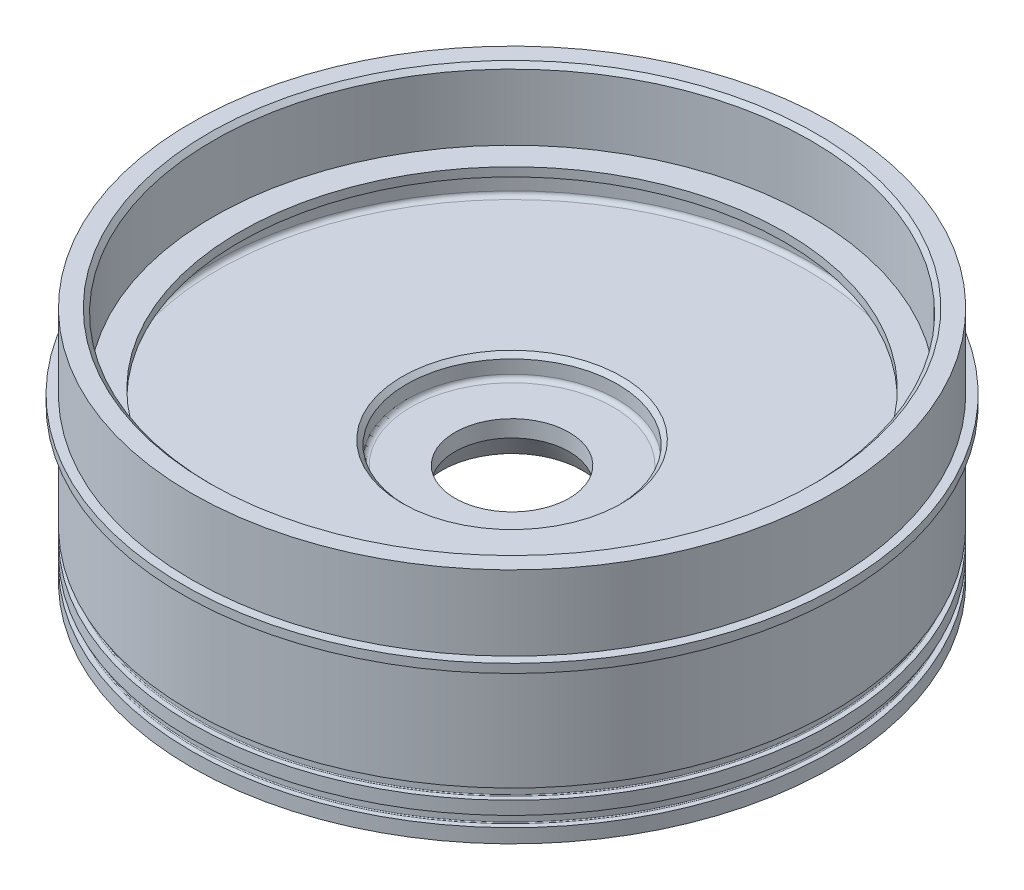
from build123d import *

# Parameters (mm, degrees)
SMUSSO1_SIZE  = 3
SMUSSO1_SIZE2 = 5.196152423
SMUSSO2_SIZE  = 1
RACCORDO1_R   = 1
SMUSSO3_SIZE  = 1
RACCORDO2_R   = 0.2
SCHIZZO2_W    = 11
SCHIZZO2_H    = 5
RACCORDO3_R   = 1
SMUSSO4_SIZE  = 1


with BuildPart() as part:
    # Schizzo1 → Rivoluzione1 (revolve)
    with BuildSketch(Plane.XY):
        Polygon((-69, 0), (-13, 0), (-13, 14), (-68, 14), (-68, 22), (-62, 22), (-62, 24), (-68, 24), (-68, 40), (-73, 40), (-73, 23), (-75, 23), (-75, 21), (-73, 21), (-73, -3), (-71.7, -3), (-71.7, -5.4), (-73, -5.4), (-73, -8.4), (-71.7, -8.4), (-71.7, -10.8), (-73, -10.8), (-73, -14), (-69, -14), align=None)
    revolve(axis=Axis((0, 0, 0), (0, 1, 0)))

    # Smusso1
    smusso1_edges = [part.edges().sort_by_distance(p)[0] for p in [
        (13, 0, 0),
    ]]
    smusso1_side = [part.faces().sort_by_distance(p)[0] for p in [
        (67.048385284, 0, 0),
    ]]
    chamfer(smusso1_edges, length=SMUSSO1_SIZE, length2=SMUSSO1_SIZE2, reference=smusso1_side[0])

    # Smusso2
    smusso2_edges = [part.edges().sort_by_distance(p)[0] for p in [
        (69, -14, 0),
    ]]
    chamfer(smusso2_edges, length=SMUSSO2_SIZE)

    # Raccordo1
    raccordo1_edges = [part.edges().sort_by_distance(p)[0] for p in [
        (69, 0, 0),
        (68, 14, 0),
    ]]
    fillet(raccordo1_edges, radius=RACCORDO1_R)

    # Smusso3
    smusso3_edges = [part.edges().sort_by_distance(p)[0] for p in [
        (68, 40, 0),
    ]]
    chamfer(smusso3_edges, length=SMUSSO3_SIZE)

    # Raccordo2
    raccordo2_edges = [part.edges().sort_by_distance(p)[0] for p in [
        (71.7, -8.4, 0),
        (71.7, -10.8, 0),
        (71.7, -3, 0),
        (71.7, -5.4, 0),
    ]]
    fillet(raccordo2_edges, radius=RACCORDO2_R)

    # Schizzo2 → Taglia-Rivoluzione1 (revolve, cut)
    with BuildSketch(Plane.XY):
        with Locations((-18.5, 11.5)):
            Rectangle(SCHIZZO2_W, SCHIZZO2_H)
    revolve(axis=Axis((0, 0, 0), (0, 1, 0)), mode=Mode.SUBTRACT)

    # Raccordo3
    raccordo3_edges = [part.edges().sort_by_distance(p)[0] for p in [
        (24, 9, 0),
    ]]
    fillet(raccordo3_edges, radius=RACCORDO3_R)

    # Smusso4
    smusso4_edges = [part.edges().sort_by_distance(p)[0] for p in [
        (24, 14, 0),
    ]]
    chamfer(smusso4_edges, length=SMUSSO4_SIZE)


solid = part.part
